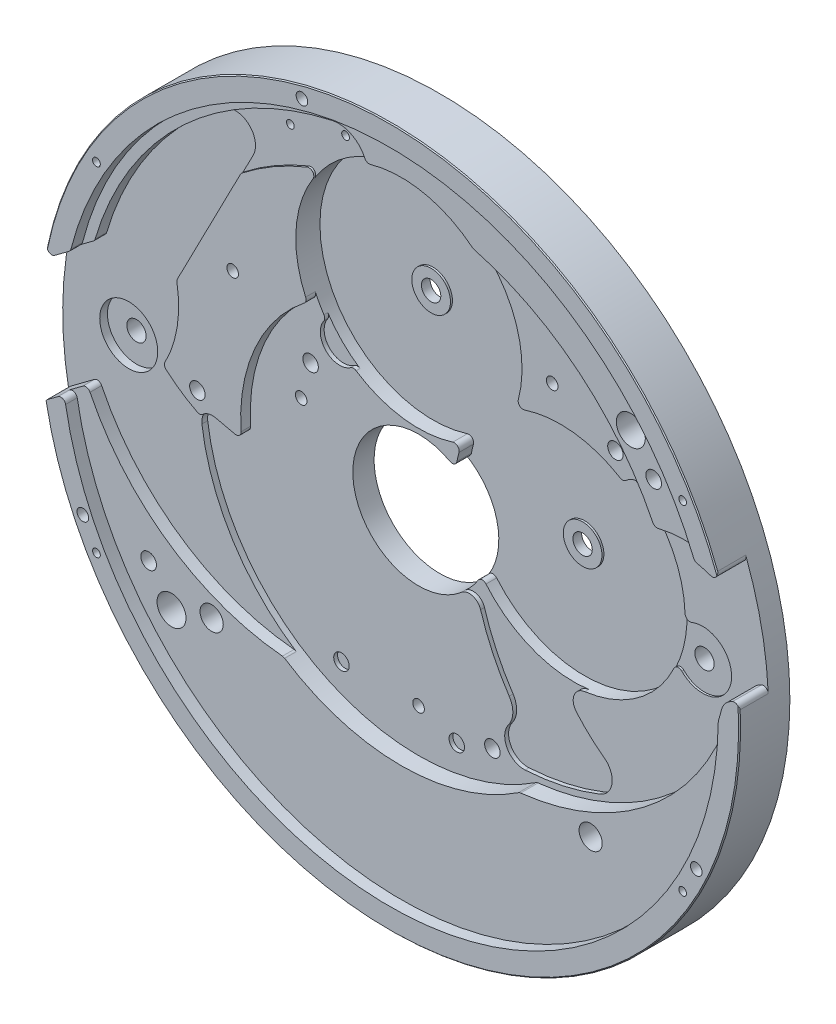
from build123d import *

# Parameters (mm, degrees)
SKETCH_1_R                = 18.1
SKETCH_1_R_2              = 3.4
EXTRUDE_1_DEPTH           = 2.6
SKETCH_20_R               = 0.4249999999999999
SKETCH_20_R_2             = 0.40500000000000136
SKETCH_20_R_3             = 0.3
SKETCH_20_R_4             = 0.40000000000000074
SKETCH_20_R_5             = 0.40000000000000036
SKETCH_20_R_6             = 0.3000000000000001
SKETCH_20_R_7             = 0.3999999999999995
SKETCH_20_R_8             = 0.39999999999999936
CUT_EXTRUDE_20_DEPTH      = 10
SKETCH_28_R               = 0.5000000000000001
SKETCH_28_R_2             = 0.5000000000000008
SKETCH_28_R_3             = 0.5000000000000043
CUT_EXTRUDE_31_DEPTH      = 10
CUT_EXTRUDE_21_DEPTH      = 2.15
CUT_EXTRUDE_32_DEPTH      = 1.5
CUT_EXTRUDE_33_DEPTH      = 1.2
SKETCH_24_R               = 17
CUT_EXTRUDE_24_DEPTH      = 0.6
SKETCH_25_R               = 0.3000000000000001
SKETCH_25_R_2             = 0.3000000000000003
SKETCH_25_R_3             = 0.30000000000000226
CUT_EXTRUDE_25_DEPTH      = 2
CUT_EXTRUDE_34_DEPTH      = 0.5
CUT_EXTRUDE_35_DEPTH      = 0.9
CUT_EXTRUDE_36_DEPTH      = 0.4
SKETCH_36_R               = 0.19999999999999993
SKETCH_36_R_2             = 0.20000000000000037
CUT_EXTRUDE_37_DEPTH      = 10
CUT_EXTRUDE_38_DEPTH      = 0.1
SKETCH_38_R               = 1.0000000000000002
SKETCH_38_R_2             = 1.0000000000000016
CUT_EXTRUDE_39_DEPTH      = 0.1
CUT_EXTRUDE_40_DEPTH      = 10
CUT_EXTRUDE_40_DEPTH_BACK = 0.1
SKETCH_39_R               = 1.5000000000000007
SKETCH_40_R               = 0.19999999999999912
SKETCH_40_R_2             = 0.20000000000000076
CUT_EXTRUDE_41_DEPTH      = 1
SKETCH_41_R               = 0.7500000000000004
CUT_EXTRUDE_42_DEPTH      = 1.5
SKETCH_42_R               = 0.4000000000000002
SKETCH_42_R_2             = 0.3999999999999998
CUT_EXTRUDE_43_DEPTH      = 0.2
CUT_EXTRUDE_44_DEPTH      = 0.5
SKETCH_44_R               = 1.0000000000000002
CUT_EXTRUDE_45_DEPTH      = 0.2
FILLET_1_R                = 0.25
SKETCH_45_R               = 0.6000000000000002
CUT_EXTRUDE_46_DEPTH      = 10


with BuildPart() as part:
    # Эскиз1 → Бобышка-Вытянуть1 (new body)
    with BuildSketch(Plane.XY):
        Circle(SKETCH_1_R)
        Circle(SKETCH_1_R_2, mode=Mode.SUBTRACT)
    extrude(amount=EXTRUDE_1_DEPTH)

    # Эскиз20 → Вырез-Вытянуть20 (cut)
    with BuildSketch(Plane.XY.offset(2.6)):
        with Locations((11.873688868344102, 9.96320795014143)):
            Circle(SKETCH_20_R)
        with Locations((13.057741358827588, 8.351370582483062)):
            Circle(SKETCH_20_R_2)
        with Locations((-11.873688868344102, -9.96320795014143)):
            Circle(SKETCH_20_R)
        with Locations((-13.057741358827588, -8.351370582483062)):
            Circle(SKETCH_20_R_2)
        with Locations((0, -8.768952460470098)):
            Circle(SKETCH_20_R_3)
        with Locations((3.816546889982909, -8.768952460470098)):
            Circle(SKETCH_20_R_4)
        with Locations((-5.582458616869897, 3.7945483353676774)):
            Circle(SKETCH_20_R_5)
        with Locations((-6.069480692372972, 1.9804562585009002)):
            Circle(SKETCH_20_R_6)
        with Locations((-10.935928421314474, 0.1356015835247779)):
            Circle(SKETCH_20_R_7)
        with Locations((-9.112495388323305, 6.401403857496992)):
            Circle(SKETCH_20_R_6)
        with Locations((10.679257850965163, 8.251019039078752)):
            Circle(SKETCH_20_R_8)
        with Locations((7.411343365714883, 9.626689995615846)):
            Circle(SKETCH_20_R_6)
    extrude(amount=-CUT_EXTRUDE_20_DEPTH, mode=Mode.SUBTRACT)

    # Эскиз28 → Вырез-Вытянуть31 (cut)
    with BuildSketch(Plane.XY.offset(2.6)):
        with Locations((0, 9.5)):
            Circle(SKETCH_28_R)
        with Locations((14.685804367436818, 0.6383509453138431)):
            Circle(SKETCH_28_R_2)
        with Locations((7.832562473612775, 2.064210526315789)):
            Circle(SKETCH_28_R_3)
        with Locations((-14.685804367436818, 0.6383509453138394)):
            Circle(SKETCH_28_R_2)
    extrude(amount=-CUT_EXTRUDE_31_DEPTH, mode=Mode.SUBTRACT)

    # Эскиз21 → Вырез-Вытянуть21 (cut)
    with BuildSketch(Plane.XY.offset(2.6)):
        with BuildLine():
            ThreePointArc((2.240188448006739, 4.09592230649696), (12.147724206760554, -2.032358674463939), (5.513135139127443, 7.543513113328324))
            ThreePointArc((5.513135139127443, 7.543513113328324), (-4.242638006540254, 13.527719298245614), (2.240188448006739, 4.09592230649696))
        make_face()
    extrude(amount=-CUT_EXTRUDE_21_DEPTH, mode=Mode.SUBTRACT)

    # Эскиз29 → Вырез-Вытянуть32 (cut)
    with BuildSketch(Plane.XY.offset(2.6)):
        with BuildLine():
            Line((11.307020552151686, 5.352565612633018), (8.945133751627438, 7.638372282024825))
            ThreePointArc((8.945133751627438, 7.638372282024825), (5.940862836267412, 7.237961061106258), (3.029703548973467, 6.394679090044472))
            ThreePointArc((3.029703548973467, 6.394679090044472), (1.9317344447833324, 3.155035353034795), (1.7168018766530144, -0.25885270717734116))
            Line((1.7168018766530144, -0.25885270717734116), (1.9822979118092192, -2.1222511143513834))
            ThreePointArc((1.9822979118092192, -2.1222511143513834), (3.487092389922303, -5.963834302365366), (6.119853463048227, -9.140426335287467))
            ThreePointArc((6.119853463048227, -9.140426335287467), (13.129747345785173, -6.1130578734707015), (17.15910274098938, 0.3729167757223115))
            ThreePointArc((17.15910274098938, 0.3729167757223115), (17.49106556510817, 0.8915249320919594), (18.065773424288896, 1.112578348817313))
            Line((18.065773424288896, 1.112578348817313), (19.525229338887293, 3.8352190917505413))
            ThreePointArc((19.525229338887293, 3.8352190917505413), (15.738872866101339, 6.341950399791734), (11.307020552151686, 5.352565612633018))
        make_face()
    extrude(amount=-CUT_EXTRUDE_32_DEPTH, mode=Mode.SUBTRACT)

    # Эскиз31 → Вырез-Вытянуть33 (cut)
    with BuildSketch(Plane.XY.offset(2.6)):
        with BuildLine():
            Line((-4.887493513582438, 5.445800036741447), (-8.8, -1.5610051810988896))
            ThreePointArc((-8.8, -1.5610051810988896), (-10.891250085820626, -0.8618054129750092), (-12.704463923321759, 0.39297058961815234))
            ThreePointArc((-12.704463923321759, 0.39297058961815234), (-11.970515796587435, 2.5196505164741527), (-12.05493767674342, 4.767832072794726))
            Line((-12.05493767674342, 4.767832072794726), (-15.801431939242564, 4.62207074010357))
            Line((-15.801431939242564, 4.62207074010357), (-20.508172140857415, 1.1109265522970306))
            Line((-20.508172140857415, 1.1109265522970306), (-17.808089056749772, -3.237586160532105))
            Line((-17.808089056749772, -3.237586160532105), (-16.215236038243123, -2.0493462368497046))
            ThreePointArc((-16.215236038243123, -2.0493462368497046), (-12.024216088045783, -7.041339260355656), (-5.868831708468086, -9.185140955787212))
            ThreePointArc((-5.868831708468086, -9.185140955787212), (-1.8229221655055081, -2.325811914455974), (-2.4588373792671576, 5.612411486783894))
            ThreePointArc((-2.4588373792671576, 5.612411486783894), (-3.7090802369039557, 6.052627261561351), (-4.887493513582438, 5.445800036741447))
        make_face()
    extrude(amount=-CUT_EXTRUDE_33_DEPTH, mode=Mode.SUBTRACT)

    # Эскиз24 → Вырез-Вытянуть24 (cut)
    with BuildSketch(Plane.XY.offset(2.6)):
        Circle(SKETCH_24_R)
    extrude(amount=-CUT_EXTRUDE_24_DEPTH, mode=Mode.SUBTRACT)

    # Эскиз25 → Вырез-Вытянуть25 (cut)
    with BuildSketch(Plane.XY.offset(2.6)):
        with Locations((-15.86038627314134, -7.395819580462322)):
            Circle(SKETCH_25_R)
        with Locations((15.860386273141348, -7.395819580462319)):
            Circle(SKETCH_25_R_2)
        with Locations((-4.529333289294007, 16.903701960058722)):
            Circle(SKETCH_25_R_3)
    extrude(amount=-CUT_EXTRUDE_25_DEPTH, mode=Mode.SUBTRACT)

    # Эскиз32 → Вырез-Вытянуть34 (cut)
    with BuildSketch(Plane.XY.offset(2)):
        with BuildLine():
            Line((-13.99603217531494, -0.33329168538827836), (-16.49588885785018, 0.368308008946658))
            ThreePointArc((-16.49588885785018, 0.368308008946658), (-12.752051836927082, 10.470681637234732), (-3.5713549825006834, 16.108861647831226))
            ThreePointArc((-3.5713549825006834, 16.108861647831226), (-2.482518739674229, 15.935174446175768), (-1.80658148115889, 15.064059970195661))
            ThreePointArc((-1.80658148115889, 15.064059970195661), (-2.2694648793577725, 14.223372182808165), (-3.0492165072911237, 13.663904225793717))
            ThreePointArc((-3.0492165072911237, 13.663904225793717), (-6.016030030120553, 12.641494479557698), (-8.68059009584244, 10.983959012485533))
            Line((-8.68059009584244, 10.983959012485533), (-12.605330475557457, 3.377745696734659))
            ThreePointArc((-12.605330475557457, 3.377745696734659), (-12.924274303708266, 1.3811694438605866), (-13.99603217531494, -0.33329168538827836))
        make_face()
    extrude(amount=-CUT_EXTRUDE_34_DEPTH, mode=Mode.SUBTRACT)

    # Эскиз33 → Вырез-Вытянуть35 (cut)
    with BuildSketch(Plane.XY.offset(2)):
        with BuildLine():
            Line((-5.25646685046143, 6.932499999999983), (3.542038427860023, 4.823344920772718))
            Line((3.542038427860023, 4.823344920772718), (2.5379812954808965, 2.102334979678408))
            ThreePointArc((2.5379812954808965, 2.102334979678408), (3.293248779061656, 0.12519545598640433), (2.690269278726118, -1.9035789006324926))
            ThreePointArc((2.690269278726118, -1.9035789006324926), (3.889994185719834, -5.779429660997666), (6.592721129344423, -8.805454452252697))
            ThreePointArc((6.592721129344423, -8.805454452252697), (-4.262072262959959, -10.14074652209151), (-10.903770432085539, -1.4518231174559737))
            ThreePointArc((-10.903770432085539, -1.4518231174559737), (-10.666713409525318, -0.7995925534653755), (-9.99610281567483, -0.6210367583645029))
            Line((-9.99610281567483, -0.6210367583645029), (-8.650908268554407, -0.9229226018791882))
            ThreePointArc((-8.650908268554407, -0.9229226018791882), (-7.986281158260334, 3.450987287895628), (-5.25646685046143, 6.932499999999983))
        make_face()
    extrude(amount=-CUT_EXTRUDE_35_DEPTH, mode=Mode.SUBTRACT)

    # Эскиз34 → Вырез-Вытянуть36 (cut)
    with BuildSketch(Plane.XY.offset(2)):
        with BuildLine():
            Line((13.68563189985495, 4.790978971115672), (4.514020668619457, 2.1502598455248045))
            ThreePointArc((4.514020668619457, 2.1502598455248045), (-1.808808370165766, 4.661353052496482), (-4.782899588036553, -1.4573508605547805))
            Line((-4.782899588036553, -1.4573508605547805), (-14.426587594514581, -1.4572475348402614))
            ThreePointArc((-14.426587594514581, -1.4572475348402614), (-3.1460034095332245, 14.154598636033638), (13.68563189985495, 4.790978971115672))
        make_face()
    extrude(amount=-CUT_EXTRUDE_36_DEPTH, mode=Mode.SUBTRACT)

    # Эскиз36 → Вырез-Вытянуть37 (cut)
    with BuildSketch(Plane.XY.offset(1.5)):
        with Locations((-6.227658907417223, 14.357533372166237)):
            Circle(SKETCH_36_R)
        with Locations((-3.373665338661414, 15.282044437270642)):
            Circle(SKETCH_36_R_2)
    extrude(amount=-CUT_EXTRUDE_37_DEPTH, mode=Mode.SUBTRACT)

    # Эскиз37 → Вырез-Вытянуть38 (cut)
    with BuildSketch(Plane.XY.offset(1.5)):
        with BuildLine():
            Line((-8.146480753506848, 12.019071962309468), (-12.007321184726619, 4.53669782879659))
            Line((-12.007321184726619, 4.53669782879659), (-13.683011213482416, 2.9622971038899086))
            ThreePointArc((-13.683011213482416, 2.9622971038899086), (-15.322904780249143, 2.9131581633291512), (-15.887604303565388, 4.453541230675943))
            ThreePointArc((-15.887604303565388, 4.453541230675943), (-13.543471374764522, 9.42466886001487), (-9.696643953384953, 13.350097229656534))
            ThreePointArc((-9.696643953384953, 13.350097229656534), (-8.395568596348546, 13.297177148221408), (-8.146480753506848, 12.019071962309468))
        make_face()
    extrude(amount=-CUT_EXTRUDE_38_DEPTH, mode=Mode.SUBTRACT)

    # Эскиз38 → Вырез-Вытянуть39 (cut)
    with BuildSketch(Plane.XY.offset(0.45)):
        with BuildLine():
            ThreePointArc((5.513135139127443, 7.543513113328326), (-4.242638006540251, 13.527719298245614), (2.240188448006738, 4.095922306496958))
            ThreePointArc((2.240188448006738, 4.095922306496958), (12.147724206760554, -2.032358674463939), (5.513135139127443, 7.543513113328326))
        make_face()
        with Locations((0, 9.5)):
            Circle(SKETCH_38_R, mode=Mode.SUBTRACT)
        with Locations((7.832562473612775, 2.064210526315789)):
            Circle(SKETCH_38_R_2, mode=Mode.SUBTRACT)
    extrude(amount=-CUT_EXTRUDE_39_DEPTH, mode=Mode.SUBTRACT)

    # Эскиз39 → Вырез-Вытянуть40 (cut, two sides: drawn at the far end of the back side and taken through both)
    with BuildSketch(Plane.XY.offset(1.0999999999999999).offset(-CUT_EXTRUDE_40_DEPTH_BACK)):
        with Locations((14.685804367436818, 0.6383509453138431)):
            Circle(SKETCH_39_R)
        with Locations(Location((-14.685804367436818, 0.6383509453138394, 0), (0, 0, 180))):
            Circle(SKETCH_39_R)
    extrude(amount=CUT_EXTRUDE_40_DEPTH + CUT_EXTRUDE_40_DEPTH_BACK, mode=Mode.SUBTRACT)

    # Эскиз40 → Вырез-Вытянуть41 (cut)
    with BuildSketch(Plane.XY.offset(2.6)):
        with Locations((-15.155444566227636, -8.750000000000078)):
            Circle(SKETCH_40_R)
        with Locations(Location((15.15544456622764, -8.750000000000075, 0), (0, 0, 180))):
            Circle(SKETCH_40_R)
        with Locations((-15.155444566227638, 8.75000000000007)):
            Circle(SKETCH_40_R_2)
        with Locations(Location((15.155444566227635, 8.750000000000073, 0), (0, 0, 180))):
            Circle(SKETCH_40_R_2)
    extrude(amount=-CUT_EXTRUDE_41_DEPTH, mode=Mode.SUBTRACT)

    # Эскиз41 → Вырез-Вытянуть42 (cut)
    with BuildSketch(Plane.XY.offset(2)):
        with Locations((-11.873688868344102, -9.96320795014143)):
            Circle(SKETCH_41_R)
        with Locations((11.873688868344102, 9.96320795014143)):
            Circle(SKETCH_41_R)
    extrude(amount=-CUT_EXTRUDE_42_DEPTH, mode=Mode.SUBTRACT)

    # Эскиз42 → Вырез-Вытянуть43 (cut)
    with BuildSketch(Plane.XY.offset(1.0999999999999999)):
        with Locations((-3.9878239505979334, -8.787477461651752)):
            Circle(SKETCH_42_R)
        with Locations((1.97598100068196, -9.445527993973863)):
            Circle(SKETCH_42_R_2)
        with BuildLine():
            Line((2.8518760304244273, -1.1908259642077534), (8.593286002897655, -3.8369588249223496))
            ThreePointArc((8.593286002897655, -3.8369588249223496), (8.040815350668927, -4.271257190928056), (8.160691795029873, -4.963693852563356))
            ThreePointArc((8.160691795029873, -4.963693852563356), (8.843582466367288, -5.6726270501057), (9.603010190049893, -6.298882173900743))
            ThreePointArc((9.603010190049893, -6.298882173900743), (10.003826699607643, -7.23303315975146), (9.379783874713086, -8.035443585529654))
            ThreePointArc((9.379783874713086, -8.035443585529654), (7.479803117431756, -8.616699451977963), (5.5116201708647665, -8.888804485306638))
            ThreePointArc((5.5116201708647665, -8.888804485306638), (4.573784275978122, -8.364995001172009), (4.651667309069073, -7.293618888612196))
            ThreePointArc((4.651667309069073, -7.293618888612196), (4.87432398041302, -6.650344624495243), (4.6865579353275, -5.996034541673561))
            ThreePointArc((4.6865579353275, -5.996034541673561), (3.8329013492860184, -4.481658437354638), (3.207009856993702, -2.859830952046699))
            ThreePointArc((3.207009856993702, -2.859830952046699), (2.7912171101867846, -2.4499008090634327), (2.2207809471881697, -2.574515873830656))
            Line((2.2207809471881697, -2.574515873830656), (2.8518760304244273, -1.1908259642077534))
        make_face()
    extrude(amount=-CUT_EXTRUDE_43_DEPTH, mode=Mode.SUBTRACT)

    # Эскиз43 → Вырез-Вытянуть44 (cut)
    with BuildSketch(Plane.XY.offset(1.6)):
        with BuildLine():
            ThreePointArc((13.099480927463278, 6.217201897238488), (12.917080936372459, 6.587793263544574), (12.724199358143887, 6.953038953882732))
            ThreePointArc((12.724199358143887, 6.953038953882732), (11.935246673753737, 7.449035420262998), (11.099239382422011, 7.037270145247833))
            ThreePointArc((11.099239382422011, 7.037270145247833), (11.689326030937975, 5.627115248722529), (13.099480927463278, 6.217201897238488))
        make_face()
    extrude(amount=-CUT_EXTRUDE_44_DEPTH, mode=Mode.SUBTRACT)

    # Эскиз44 → Вырез-Вытянуть45 (cut)
    with BuildSketch(Plane.XY.offset(1.0999999999999999)):
        with Locations((-4.081696984191996, 5.4387928628739735)):
            Circle(SKETCH_44_R)
    extrude(amount=-CUT_EXTRUDE_45_DEPTH, mode=Mode.SUBTRACT)

    # Скругление1
    fillet_1_edges = [part.edges().sort_by_distance(p)[0] for p in [
        (1.928271733293288, 2.800315718375715, 0.7250000000000001),
        (17.108613120878598, 5.9080755817864175, 1.85),
        (18.065773424288896, 1.1125783488173129, 1.85),
        (6.119853463048226, -9.140426335287467, 1.55),
        (-17.831176283874566, 3.1079176844616407, 2),
        (-12.704463923321757, 0.39297058961815234, 1.5),
        (-16.215236038243123, -2.049346236849705, 1.7000000000000002),
        (-17.808089056749772, -3.237586160532105, 2),
        (-16.81558805180392, -2.497198124304364, 2.3),
        (15.775518449915133, 6.335062559784818, 2.3),
        (-16.49747735416071, 4.10283328310504, 2.3),
        (16.998891355785698, -0.19414601256369513, 2.3),
        (-15.849902366027028, 4.585912666788522, 1.7),
        (-4.477750240087518, 13.2646052631579, 1.55),
        (-8.68059009584244, 10.983959012485535, 1.55),
        (-1.80658148115889, 15.064059970195661, 1.75),
        (-6.076096918958016, -9.169571758344695, 1.7000000000000002),
        (-10.772737752747702, -0.9198702490849874, 1.5),
        (-8.650908268554407, -0.9229226018791882, 1.35),
        (-5.256466850461431, 6.932499999999984, 1.35),
        (-12.007321184726617, 4.536697828796588, 1.5),
        (13.099480927463297, 6.217201897238461, 1.55),
        (3.720327850857643, 14.014605263157897, 1.8),
        (13.778048819070522, 1.8324949334535454, 1.05),
        (13.377095611468903, -0.09464386507221978, 1.05),
        (11.099239382422011, 7.037270145247833, 1.35),
        (-4.791247638888311, 6.143447294790806, 1),
        (-3.380622312676315, 4.725704996647671, 1),
        (3.05795830963647, -1.486233822965034, 0.625),
        (5.513135139127442, 7.543513113328325, 0.9750000000000001),
        (2.240188448006738, 4.095922306496959, 0.7250000000000001),
    ]]
    fillet(fillet_1_edges, radius=FILLET_1_R)

    # Фаска1: read off the stored shape, not the designer's step
    # Фаска1 outline → Фаска1 (revolve, cut)
    with BuildSketch(Plane.XZ):
        Polygon((18.100002185, 2.6), (18.05, 2.6), (18.100002185, 2.549997815), align=None)
    revolve(axis=Axis((0, 0, 0), (0, 0, 1)), mode=Mode.SUBTRACT)

    # Эскиз45 → Вырез-Вытянуть46 (cut)
    with BuildSketch(Plane.XY.offset(2)):
        with Locations((-9.798665177026452, -9.28634270035998)):
            Circle(SKETCH_45_R)
        with Locations((9.798665177026452, -9.28634270035998)):
            Circle(SKETCH_45_R)
    extrude(amount=-CUT_EXTRUDE_46_DEPTH, mode=Mode.SUBTRACT)


solid = part.part
